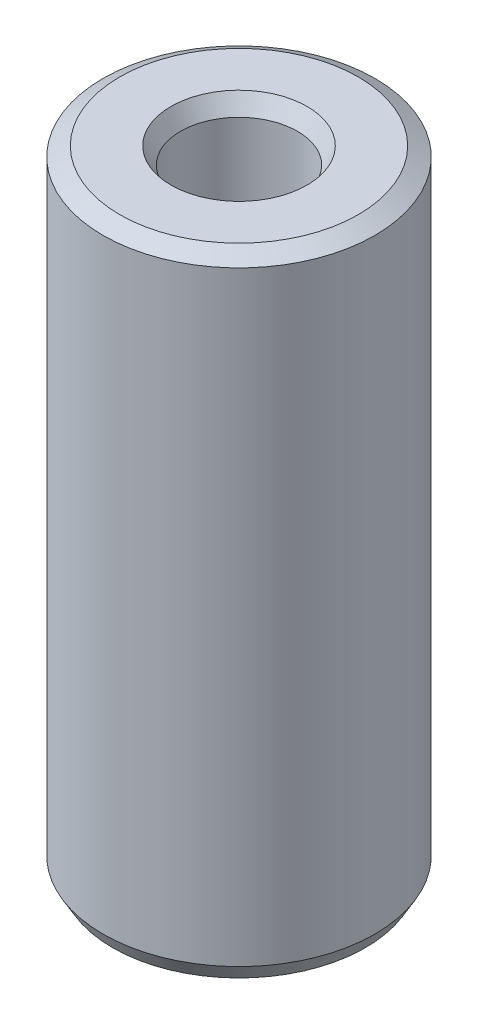
from build123d import *
from OCP.BRepFilletAPI import BRepFilletAPI_MakeChamfer

# Parameters (mm, degrees)
SKETCH1_R           = 27.5
BOSS_EXTRUDE1_DEPTH = 127.706571238
SKETCH2_R           = 11.83116645
CUT_EXTRUDE1_DEPTH  = 134.497072392
CHAMFER1_SIZE       = 1.94711344
CHAMFER1_SIZE2      = 3.372499406


with BuildPart() as part:
    # Sketch1 → Boss-Extrude1 (new body)
    with BuildSketch(Plane(origin=(0, 0, 0), x_dir=(1, 0, 0), z_dir=(0, 1, 0))):
        Circle(SKETCH1_R)
    extrude(amount=BOSS_EXTRUDE1_DEPTH)

    # Sketch2 → Cut-Extrude1 (cut, through all)
    with BuildSketch(Plane(origin=(0, 0, 0), x_dir=(1, 0, 0), z_dir=(0, 1, 0))):
        Circle(SKETCH2_R)
    extrude(amount=CUT_EXTRUDE1_DEPTH, mode=Mode.SUBTRACT)

    # Chamfer1: one chamfer whose edges measure the first distance from different faces: ONE call of the kernel's chamfer builder (chamfer() names one face for all edges)
    chamfer1_edges_1 = [part.edges().sort_by_distance(p)[0] for p in [
        (-11.83116645, 127.706571238, 0),
    ]]
    chamfer1_side_1 = [part.faces().sort_by_distance(p)[0] for p in [
        (-26.722182541, 127.706571238, 0),
    ]]
    chamfer1_edges_2 = [part.edges().sort_by_distance(p)[0] for p in [
        (-11.83116645, 0, 0),
    ]]
    chamfer1_side_2 = [part.faces().sort_by_distance(p)[0] for p in [
        (-11.83116645, 63.853285619, 0),
    ]]
    chamfer1_edges_3 = [part.edges().sort_by_distance(p)[0] for p in [
        (-27.5, 0, 0),
    ]]
    chamfer1_side_3 = [part.faces().sort_by_distance(p)[0] for p in [
        (-26.722182541, 0, 0),
    ]]
    chamfer1_edges_4 = [part.edges().sort_by_distance(p)[0] for p in [
        (-27.5, 127.706571238, 0),
    ]]
    chamfer1_side_4 = [part.faces().sort_by_distance(p)[0] for p in [
        (-27.5, 63.853285619, 0),
    ]]
    chamfer1 = BRepFilletAPI_MakeChamfer(part.part.solid().wrapped)
    for e in chamfer1_edges_1:
        chamfer1.Add(CHAMFER1_SIZE, CHAMFER1_SIZE2, e.wrapped, chamfer1_side_1[0].wrapped)  # the first distance lies on this face
    for e in chamfer1_edges_2:
        chamfer1.Add(CHAMFER1_SIZE, CHAMFER1_SIZE2, e.wrapped, chamfer1_side_2[0].wrapped)  # the first distance lies on this face
    for e in chamfer1_edges_3:
        chamfer1.Add(CHAMFER1_SIZE, CHAMFER1_SIZE2, e.wrapped, chamfer1_side_3[0].wrapped)  # the first distance lies on this face
    for e in chamfer1_edges_4:
        chamfer1.Add(CHAMFER1_SIZE, CHAMFER1_SIZE2, e.wrapped, chamfer1_side_4[0].wrapped)  # the first distance lies on this face
    add(Compound.cast(chamfer1.Shape()), mode=Mode.REPLACE)


solid = part.part
